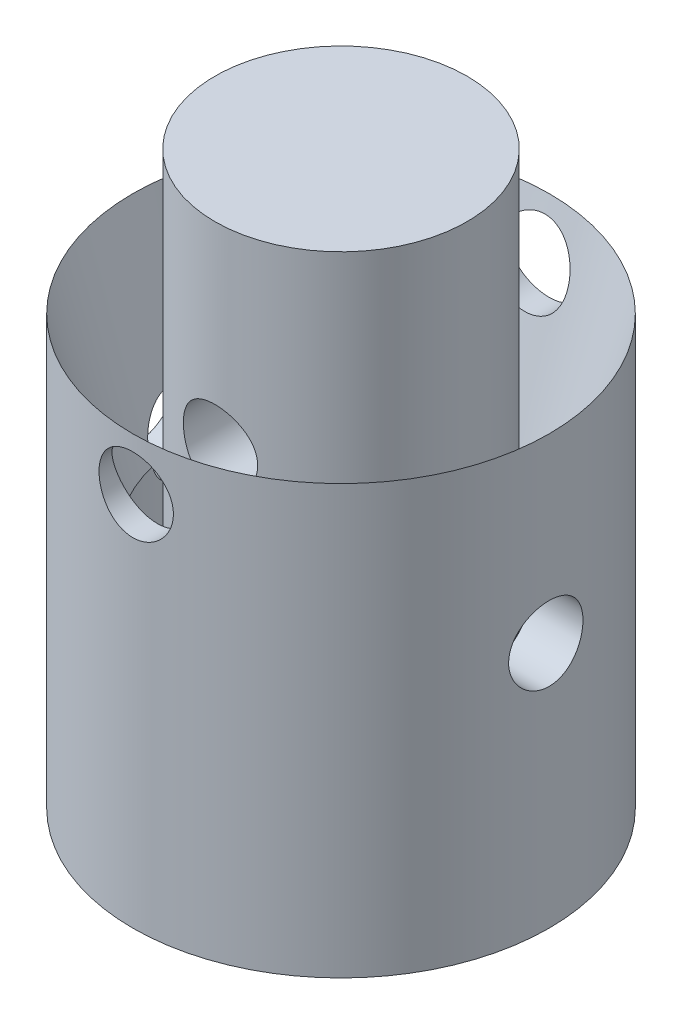
from build123d import *

# Parameters (mm, degrees)
CUT_EXTRUDE1_DEPTH      = 69.585879378
CUT_EXTRUDE1_DEPTH_BACK = 69.585879378
SKETCH2_R               = 3.96875
CUT_EXTRUDE2_DEPTH      = 69.585879531
CUT_EXTRUDE2_DEPTH_BACK = 69.585879531
SKETCH4_R               = 3.96875


with BuildPart() as part:
    # Sketch1 → Revolve1 (revolve)
    with BuildSketch(Plane.YZ):
        Polygon((0, 0), (60.96, 0), (60.96, 13.462), (12.7, 13.462), (12.7, 16.7005), (25.4, 16.7005), (45.72, 22.225), (0, 22.225), align=None)
    revolve(axis=Axis((0, 0, 0), (0, 1, 0)))

    # Sketch2 → Cut-Extrude1 (cut, two sides: drawn at the far end of the back side and taken through both)
    with BuildSketch(Plane(origin=(0, 0, 0), x_dir=(0, 1, 0), z_dir=(0, 0, 1)).offset(-CUT_EXTRUDE1_DEPTH_BACK)):
        with Locations((40.089666667, 0)):
            Circle(SKETCH2_R)
    extrude(amount=CUT_EXTRUDE1_DEPTH + CUT_EXTRUDE1_DEPTH_BACK, mode=Mode.SUBTRACT)

    # Sketch4 → Cut-Extrude2 (cut, two sides: drawn at the far end of the back side and taken through both)
    with BuildSketch(Plane.YZ.offset(-CUT_EXTRUDE2_DEPTH_BACK)):
        with Locations((26.331333333, 0)):
            Circle(SKETCH4_R)
    extrude(amount=CUT_EXTRUDE2_DEPTH + CUT_EXTRUDE2_DEPTH_BACK, mode=Mode.SUBTRACT)


solid = part.part
